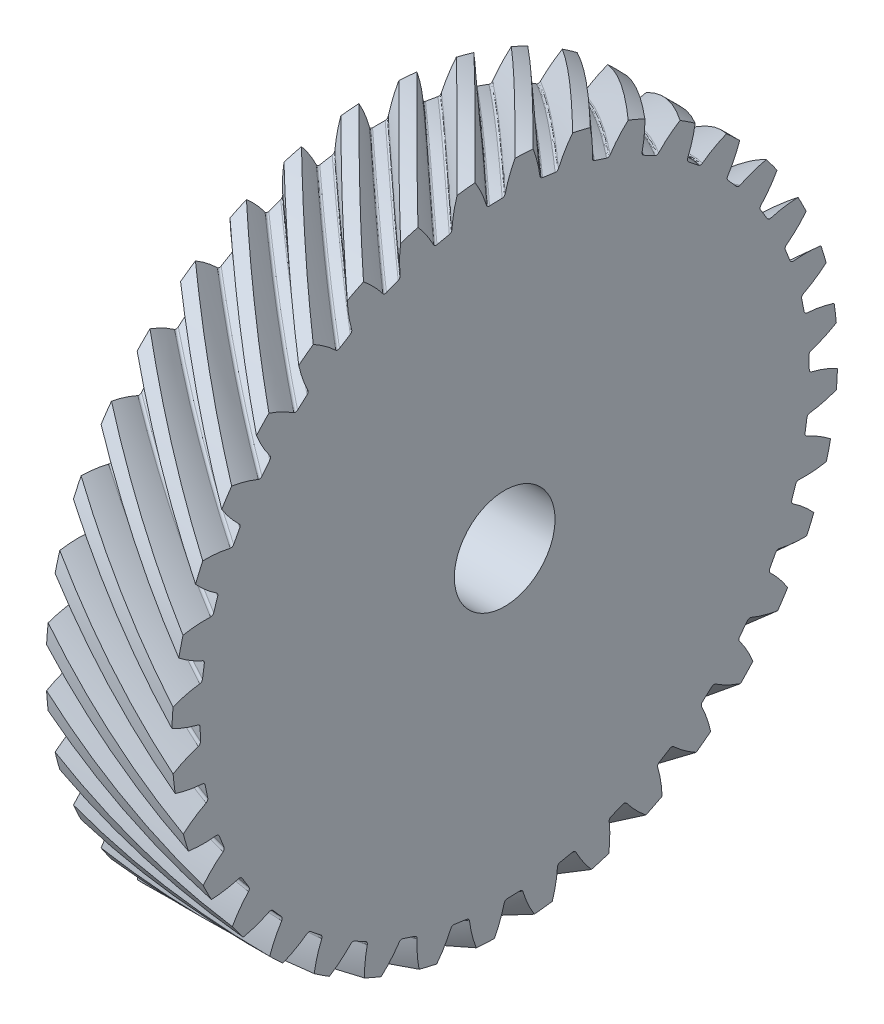
from build123d import *

# Parameters (mm, degrees)
BASPROSKE_W            = 25
BASPROSKE_H            = 66.139610307
TOOTHCUTRH_PITCH       = 415.567427702
TOOTHCUTRH_HEIGHT      = 25
TOOTHCUTRH_RADIUS      = 66.139610307
TOOTHCUTRH_START_ANGLE = -90
TEETHCUTSRH_COUNT      = 36
TEETHCUTSRH_ANGLE      = 350
BORSKE_R               = 10
BORE_DEPTH             = 62.5000025


with BuildPart() as part:
    # BasProSke → Base-Revolve (revolve)
    with BuildSketch(Plane(origin=(0, 0, 0), x_dir=(1, 0, 0), z_dir=(0, 1, 0)), mode=Mode.PRIVATE) as base_revolve_sk:
        with Locations((12.5, 33.069805153)):
            Rectangle(BASPROSKE_W, BASPROSKE_H)
    revolve(base_revolve_sk.sketch.rotate(Axis((-10, 0, 0), (1, 0, 0)), 180), axis=Axis((-10, 0, 0), (1, 0, 0)))

    # ToothCutRH: sweep along a helix
    with BuildLine() as toothcutrh_path:
        add(Helix(TOOTHCUTRH_PITCH, TOOTHCUTRH_HEIGHT, TOOTHCUTRH_RADIUS, center=(0, 0, 0), direction=(1, 0, 0), mode=Mode.PRIVATE).rotate(Axis((0, 0, 0), (1, 0, 0)), TOOTHCUTRH_START_ANGLE))
    # TooCutSkeRH → ToothCutRH (sweep, cut)
    with BuildSketch(Plane(origin=(0, 0, 0), x_dir=(0, 0, -1), z_dir=(1, 0, 0))):
        with BuildLine():
            ThreePointArc((1.253648383, 60.501623336), (0, 60.514610307), (-1.253648383, 60.501623336))
            ThreePointArc((-1.253648383, 60.501623336), (-1.640191282, 60.625176169), (-1.869744473, 60.959819333))
            ThreePointArc((-1.869744473, 60.959819333), (-3.22341194, 64.586085612), (-5.178565443, 67.92668399))
            ThreePointArc((-5.178565443, 67.92668399), (0, 68.123798616), (5.178565443, 67.92668399))
            ThreePointArc((5.178565443, 67.92668399), (3.22341194, 64.586085612), (1.869744473, 60.959819333))
            ThreePointArc((1.869744473, 60.959819333), (1.640191282, 60.625176169), (1.253648383, 60.501623336))
        make_face()
    toothcutrh = sweep(path=toothcutrh_path.line, is_frenet=True, mode=Mode.SUBTRACT)

    # TeethCutsRH: ToothCutRH ×36 about axis
    teethcutsrh_axis = Axis((-10, 0, 0), (1, 0, 0))
    for i in range(1, TEETHCUTSRH_COUNT):
        add(toothcutrh.rotate(teethcutsrh_axis, i * TEETHCUTSRH_ANGLE / (TEETHCUTSRH_COUNT - 1)), mode=Mode.SUBTRACT)

    # BorSke → Bore (cut, symmetric)
    with BuildSketch(Plane(origin=(0, 0, 0), x_dir=(0, 0, -1), z_dir=(1, 0, 0))):
        with Locations(Location((0, 0, 0), (0, 0, 180))):
            Circle(BORSKE_R)
    extrude(amount=BORE_DEPTH, both=True, mode=Mode.SUBTRACT)


solid = part.part
